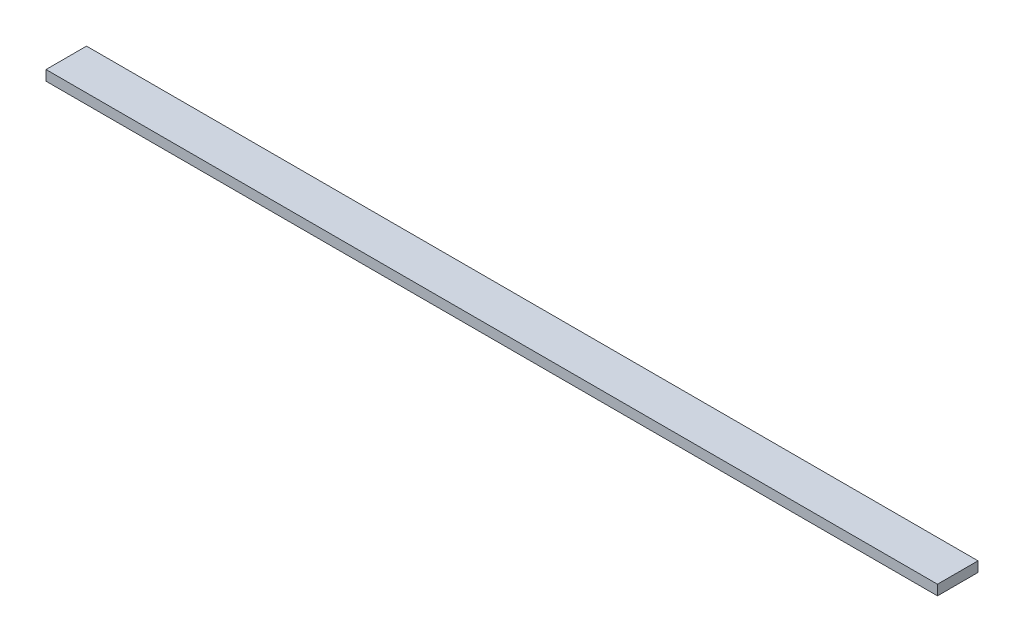
from build123d import *

# Parameters (mm, degrees)
SKETCH1_W           = 558.8
SKETCH1_H           = 25.4
BOSS_EXTRUDE1_DEPTH = 6.35


with BuildPart() as part:
    # Sketch1 → Boss-Extrude1 (new body)
    with BuildSketch(Plane(origin=(0, 0, 0), x_dir=(1, 0, 0), z_dir=(0, 1, 0))):
        with Locations((279.4, 12.7)):
            Rectangle(SKETCH1_W, SKETCH1_H)
    extrude(amount=BOSS_EXTRUDE1_DEPTH)


solid = part.part
